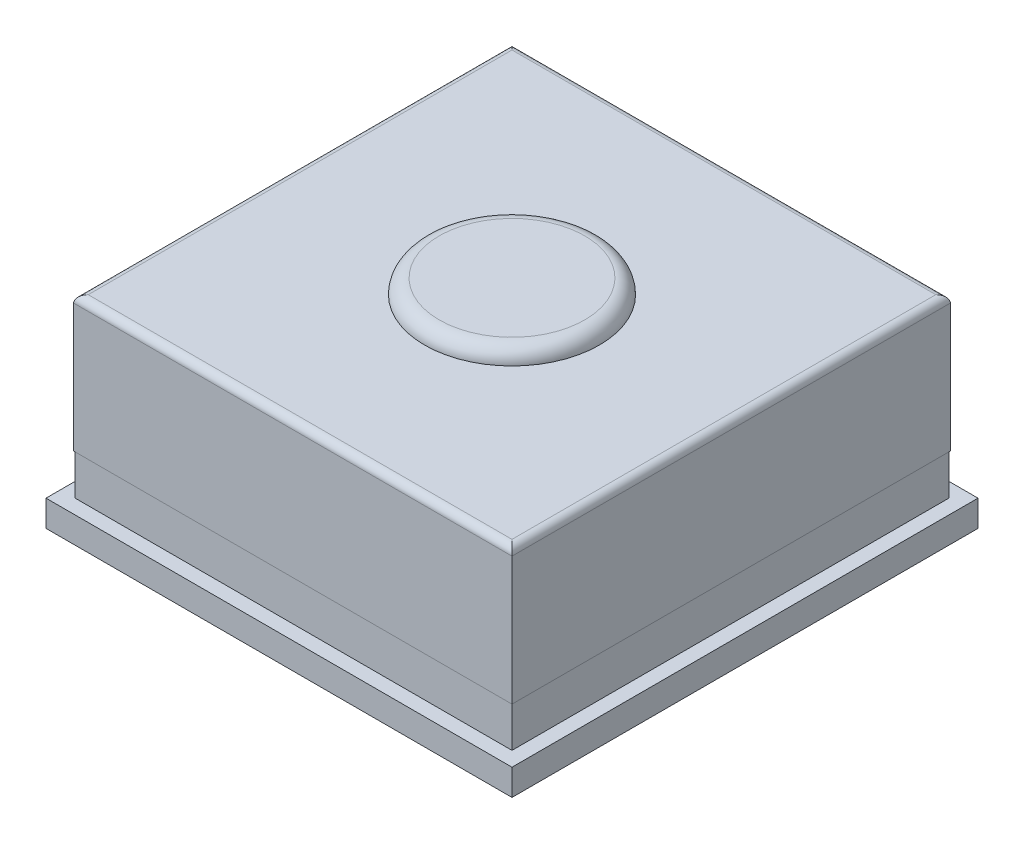
from build123d import *

# Parameters (mm, degrees)
ESQUISSE1_W        = 16
ESQUISSE1_H        = 16
BOSS_EXTRU_1_DEPTH = 0.9
ESQUISSE2_W        = 15
ESQUISSE2_H        = 15
BOSS_EXTRU_2_DEPTH = 2.3
ESQUISSE3_W        = 15.05
ESQUISSE3_H        = 15.05
BOSS_EXTRU_3_DEPTH = 4.65
ESQUISSE4_R        = 3
BOSS_EXTRU_4_DEPTH = 0.5
CONG_1_R           = 0.5
CONG_2_R           = 0.25


with BuildPart() as part:
    # Esquisse1 → Boss.-Extru.1 (new body)
    with BuildSketch(Plane(origin=(0, 0, 0), x_dir=(1, 0, 0), z_dir=(0, 1, 0))):
        Rectangle(ESQUISSE1_W, ESQUISSE1_H)
    extrude(amount=BOSS_EXTRU_1_DEPTH)

    # Esquisse2 → Boss.-Extru.2 (add)
    with BuildSketch(Plane(origin=(0, 0, 0), x_dir=(1, 0, 0), z_dir=(0, 1, 0))):
        Rectangle(ESQUISSE2_W, ESQUISSE2_H)
    extrude(amount=BOSS_EXTRU_2_DEPTH)

    # Esquisse3 → Boss.-Extru.3 (add)
    with BuildSketch(Plane(origin=(0, 2.3, 0), x_dir=(1, 0, 0), z_dir=(0, 1, 0))):
        Rectangle(ESQUISSE3_W, ESQUISSE3_H)
    extrude(amount=BOSS_EXTRU_3_DEPTH)

    # Esquisse4 → Boss.-Extru.4 (add)
    with BuildSketch(Plane(origin=(0, 6.95, 0), x_dir=(1, 0, 0), z_dir=(0, 1, 0))):
        with Locations(Location((0, 0, 0), (0, 0, 90))):
            Circle(ESQUISSE4_R)
    extrude(amount=BOSS_EXTRU_4_DEPTH)

    # Congé1
    cong_1_edges = [part.edges().sort_by_distance(p)[0] for p in [
        (0, 7.45, 3),
    ]]
    fillet(cong_1_edges, radius=CONG_1_R - 0.0001)  # a hair under: the kernel refuses the full size

    # Congé2
    cong_2_edges = [part.edges().sort_by_distance(p)[0] for p in [
        (7.525, 6.95, 0),
        (0, 6.95, -7.525),
        (-7.525, 6.95, 0),
        (0, 6.95, 7.525),
    ]]
    fillet(cong_2_edges, radius=CONG_2_R)


solid = part.part
